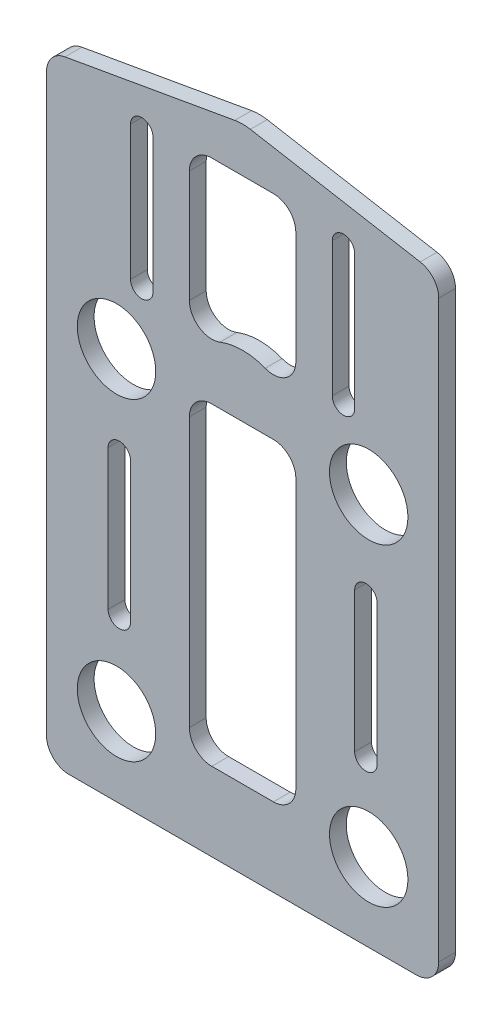
from build123d import *

# Parameters (mm, degrees)
SKETCH1_R           = 3.5
BOSS_EXTRUDE1_DEPTH = 1.5


with BuildPart() as part:
    # Sketch1 → Boss-Extrude1 (new body)
    with BuildSketch(Plane(origin=(0, 0, 0), x_dir=(-1, 0, 0), z_dir=(0, 0, -1))):
        with BuildLine():
            Line((15.847296355, 27.779408386), (0.694592711, 30.451238869))
            ThreePointArc((0.694592711, 30.451238869), (0, 30.512007857), (-0.694592711, 30.451238869))
            Line((-0.694592711, 30.451238869), (-15.847296355, 27.779408386))
            ThreePointArc((-15.847296355, 27.779408386), (-17.032088886, 27.0953681), (-17.5, 25.80979288))
            Line((-17.5, 25.80979288), (-17.5, -25.487992143))
            ThreePointArc((-17.5, -25.487992143), (-16.914213562, -26.902205705), (-15.5, -27.487992143))
            Line((-15.5, -27.487992143), (15.5, -27.487992143))
            ThreePointArc((15.5, -27.487992143), (16.914213562, -26.902205705), (17.5, -25.487992143))
            Line((17.5, -25.487992143), (17.5, 25.80979288))
            ThreePointArc((17.5, 25.80979288), (17.032088886, 27.0953681), (15.847296355, 27.779408386))
        make_face()
        with Locations((11.25, 7.512007857)):
            Circle(SKETCH1_R, mode=Mode.SUBTRACT)
        with Locations((11.25, -20.487992143)):
            Circle(SKETCH1_R, mode=Mode.SUBTRACT)
        with Locations((-11.25, -20.487992143)):
            Circle(SKETCH1_R, mode=Mode.SUBTRACT)
        with Locations((-11.25, 7.512007857)):
            Circle(SKETCH1_R, mode=Mode.SUBTRACT)
        with BuildLine():
            Line((-4.75, 14.512007857), (-4.75, 24.512007857))
            ThreePointArc((-4.75, 24.512007857), (-4.164213562, 25.92622142), (-2.75, 26.512007857))
            Line((-2.75, 26.512007857), (2.75, 26.512007857))
            ThreePointArc((2.75, 26.512007857), (4.164213562, 25.92622142), (4.75, 24.512007857))
            Line((4.75, 24.512007857), (4.75, 14.512007857))
            ThreePointArc((4.75, 14.512007857), (3.875930191, 12.859046513), (2.017718795, 12.650888776))
            ThreePointArc((2.017718795, 12.650888776), (0, 13.033559582), (-2.017718795, 12.650888776))
            ThreePointArc((-2.017718795, 12.650888776), (-3.875930191, 12.859046513), (-4.75, 14.512007857))
        make_face(mode=Mode.SUBTRACT)
        with BuildLine():
            Line((4.75, 5.512007857), (4.75, -18.487992143))
            ThreePointArc((4.75, -18.487992143), (4.164213562, -19.902205705), (2.75, -20.487992143))
            Line((2.75, -20.487992143), (-2.75, -20.487992143))
            ThreePointArc((-2.75, -20.487992143), (-4.164213562, -19.902205705), (-4.75, -18.487992143))
            Line((-4.75, -18.487992143), (-4.75, 5.512007857))
            ThreePointArc((-4.75, 5.512007857), (-4.164213562, 6.92622142), (-2.75, 7.512007857))
            Line((-2.75, 7.512007857), (2.75, 7.512007857))
            ThreePointArc((2.75, 7.512007857), (4.164213562, 6.92622142), (4.75, 5.512007857))
        make_face(mode=Mode.SUBTRACT)
        with BuildLine():
            Line((12, -0.487992143), (12, -12.987992143))
            ThreePointArc((12, -12.987992143), (11, -13.987992143), (10, -12.987992143))
            Line((10, -12.987992143), (10, -0.487992143))
            ThreePointArc((10, -0.487992143), (11, 0.512007857), (12, -0.487992143))
        make_face(mode=Mode.SUBTRACT)
        with BuildLine():
            Line((10, 25.512007857), (10, 13.512007857))
            ThreePointArc((10, 13.512007857), (9, 12.512007857), (8, 13.512007857))
            Line((8, 13.512007857), (8, 25.512007857))
            ThreePointArc((8, 25.512007857), (9, 26.512007857), (10, 25.512007857))
        make_face(mode=Mode.SUBTRACT)
        with BuildLine():
            Line((-10, -0.487992143), (-10, -12.987992143))
            ThreePointArc((-10, -12.987992143), (-11, -13.987992143), (-12, -12.987992143))
            Line((-12, -12.987992143), (-12, -0.487992143))
            ThreePointArc((-12, -0.487992143), (-11, 0.512007857), (-10, -0.487992143))
        make_face(mode=Mode.SUBTRACT)
        with BuildLine():
            Line((-8, 25.512007857), (-8, 13.512007857))
            ThreePointArc((-8, 13.512007857), (-9, 12.512007857), (-10, 13.512007857))
            Line((-10, 13.512007857), (-10, 25.512007857))
            ThreePointArc((-10, 25.512007857), (-9, 26.512007857), (-8, 25.512007857))
        make_face(mode=Mode.SUBTRACT)
    extrude(amount=-BOSS_EXTRUDE1_DEPTH)


solid = part.part
